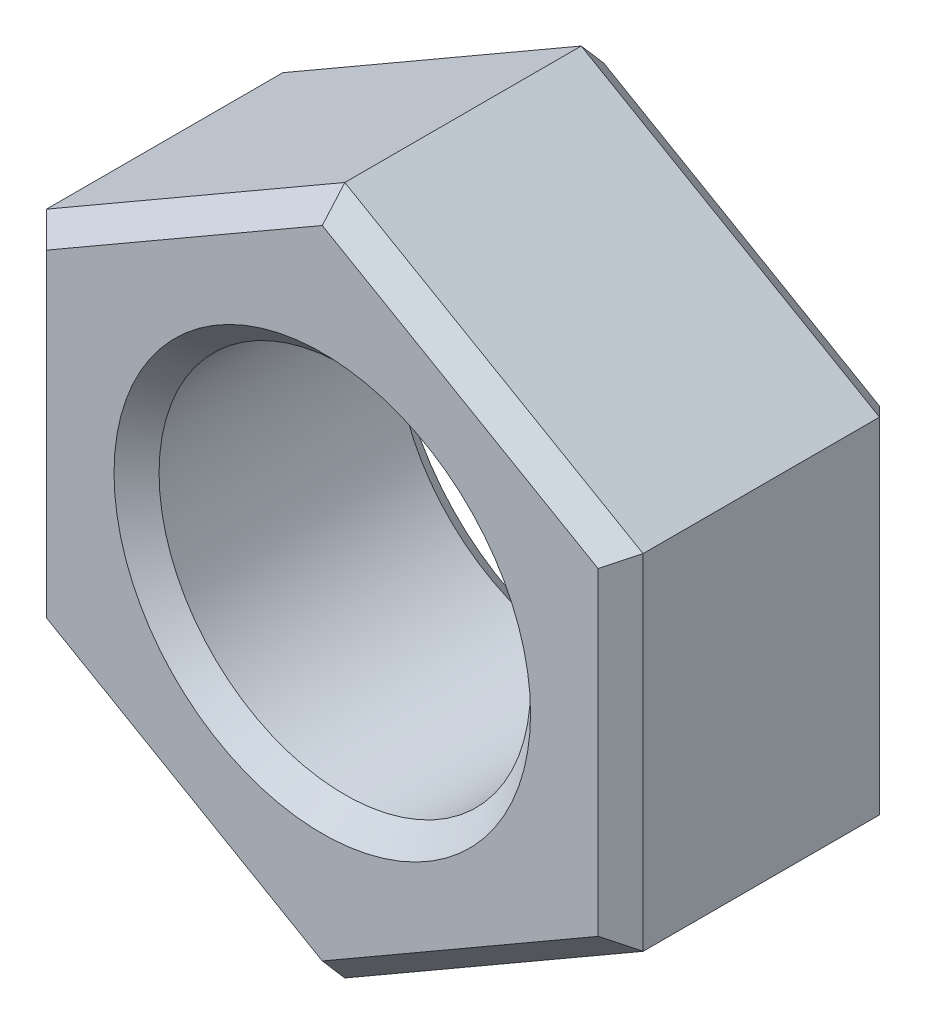
from build123d import *

# Parameters (mm, degrees)
SKETCH1_R           = 1.65
BOSS_EXTRUDE1_DEPTH = 1.25
DEBURS_SIZE         = 0.2


with BuildPart() as part:
    # Sketch1 → Boss-Extrude1 (new, symmetric)
    with BuildSketch(Plane.XY):
        Polygon((2.65, -1.529978213), (2.65, 1.529978213), (0, 3.059956427), (-2.65, 1.529978213), (-2.65, -1.529978213), (0, -3.059956427), align=None)
        Circle(SKETCH1_R, mode=Mode.SUBTRACT)
    extrude(amount=BOSS_EXTRUDE1_DEPTH, both=True)

    # Deburs
    deburs_edges = [part.edges().sort_by_distance(p)[0] for p in [
        (-1.65, 0, -1.25),
        (2.65, 0, -1.25),
        (1.325, 2.29496732, -1.25),
        (-1.325, 2.29496732, -1.25),
        (-2.65, 0, -1.25),
        (-1.325, -2.29496732, -1.25),
        (1.325, -2.29496732, -1.25),
        (-1.65, 0, 1.25),
        (-1.325, -2.29496732, 1.25),
        (-2.65, 0, 1.25),
        (-1.325, 2.29496732, 1.25),
        (1.325, 2.29496732, 1.25),
        (2.65, 0, 1.25),
        (1.325, -2.29496732, 1.25),
    ]]
    chamfer(deburs_edges, length=DEBURS_SIZE)


solid = part.part
